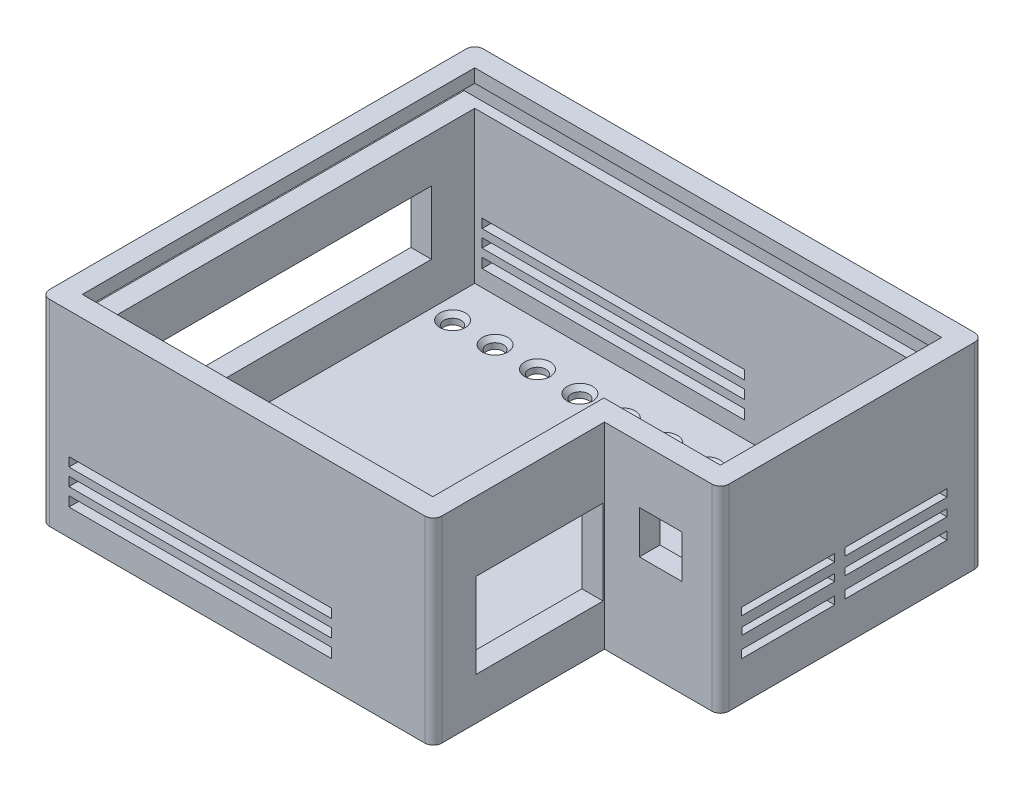
from build123d import *

# Parameters (mm, degrees)
BOSS_EXTRUDE1_DEPTH = 55.88
SKETCH25_W          = 88.9
SKETCH25_H          = 19.05
CUT_EXTRUDE9_DEPTH  = 45
SKETCH26_W          = 30.523269702
SKETCH26_H          = 2.237493103
SKETCH26_W_2        = 27.906523593
SKETCH26_H_2        = 2.373023229
SKETCH26_W_3        = 27.753916876
SKETCH26_H_3        = 2.119290111
SKETCH26_W_4        = 27.886795766
CUT_EXTRUDE10_DEPTH = 45
SKETCH27_W          = 78.529626093
SKETCH27_H          = 2.934693649
SKETCH27_H_2        = 2.6992147
SKETCH27_H_3        = 2.709324196
CUT_EXTRUDE11_DEPTH = 254
SKETCH23_W          = 12.7
SKETCH23_H          = 12.812800452
CUT_EXTRUDE12_DEPTH = 50.8
SKETCH31_W          = 123.564738067
SKETCH31_H          = 6.504927573
CUT_EXTRUDE13_DEPTH = 113.8
SKETCH34_W          = 2.794
SKETCH34_H          = 6
SKETCH34_W_2        = 3
SKETCH34_H_2        = 6.504927573
CUT_EXTRUDE14_DEPTH = 35.8
SKETCH35_W          = 66.242375008
SKETCH35_H          = 6
CUT_EXTRUDE15_DEPTH = 2.8
BOSS_EXTRUDE2_DEPTH = 3
SKETCH38_W          = 38.1
SKETCH38_H          = 25.4
CUT_EXTRUDE17_DEPTH = 10.16
FILLET1_R           = 2.54
SKETCH37_R          = 2.54
CUT_EXTRUDE18_DEPTH = 5.842
CHAMFER1_SIZE       = 1.27


with BuildPart() as part:
    # Sketch1 → Boss-Extrude1 (new body)
    with BuildSketch(Plane(origin=(0, 0, 0), x_dir=(1, 0, 0), z_dir=(0, 1, 0))):
        Polygon((104.775, 6.175), (-6.175, 6.175), (-6.175, -123.65), (104.902, -123.65), (111.252, -123.65), (111.252, -72.417375008), (145.95, -72.417375008), (145.95, 6.175), align=None)
        Polygon((0, 0), (104.775, 0), (139.775, 0), (139.775, -66.242375008), (107.949403386, -66.242375008), (104.902, -66.242375008), (104.902, -117.475), (0, -117.475), align=None, mode=Mode.SUBTRACT)
    extrude(amount=BOSS_EXTRUDE1_DEPTH)

    # Sketch25 → Cut-Extrude9 (cut)
    with BuildSketch(Plane.ZY.offset(6.175)):
        with Locations((57.39554729, 22.225)):
            Rectangle(SKETCH25_W, SKETCH25_H)
    extrude(amount=-CUT_EXTRUDE9_DEPTH, mode=Mode.SUBTRACT)

    # Sketch26 → Cut-Extrude10 (cut)
    with BuildSketch(Plane(origin=(145.95, 0, 0), x_dir=(0, 0, -1), z_dir=(1, 0, 0))):
        with Locations((-19.859686164, 20.955094684)):
            Rectangle(SKETCH26_W, SKETCH26_H)
        with Locations((-52.150571232, 9.901663162)):
            Rectangle(SKETCH26_W_2, SKETCH26_H_2)
        with Locations((-19.859686164, 9.901663162)):
            Rectangle(SKETCH26_W, SKETCH26_H_2)
        with Locations((-52.074267873, 15.812585987)):
            Rectangle(SKETCH26_W_3, SKETCH26_H_3)
        with Locations((-19.859686164, 15.812585987)):
            Rectangle(SKETCH26_W, SKETCH26_H_3)
        with Locations((-52.140707318, 20.955094684)):
            Rectangle(SKETCH26_W_4, SKETCH26_H)
    extrude(amount=-CUT_EXTRUDE10_DEPTH, mode=Mode.SUBTRACT)

    # Sketch27 → Cut-Extrude11 (cut)
    with BuildSketch(Plane(origin=(0, 0, -6.175), x_dir=(-1, 0, 0), z_dir=(0, 0, -1))):
        with Locations((-41.456138019, 6.407058623)):
            Rectangle(SKETCH27_W, SKETCH27_H)
        with Locations((-41.456138019, 11.590217132)):
            Rectangle(SKETCH27_W, SKETCH27_H_2)
        with Locations((-41.456138019, 16.660698202)):
            Rectangle(SKETCH27_W, SKETCH27_H_3)
    extrude(amount=-CUT_EXTRUDE11_DEPTH, mode=Mode.SUBTRACT)

    # Sketch23 → Cut-Extrude12 (cut)
    with BuildSketch(Plane.XY.offset(72.417375008)):
        with Locations((128.04011729, 32.5625418)):
            Rectangle(SKETCH23_W, SKETCH23_H)
    extrude(amount=-CUT_EXTRUDE12_DEPTH, mode=Mode.SUBTRACT)

    # Sketch31 → Cut-Extrude13 (cut)
    with BuildSketch(Plane.ZY.offset(6.175)):
        with Locations((58.782369034, 48.622896581)):
            Rectangle(SKETCH31_W, SKETCH31_H)
    extrude(amount=-CUT_EXTRUDE13_DEPTH, mode=Mode.SUBTRACT)

    # Sketch34 → Cut-Extrude14 (cut)
    with BuildSketch(Plane.ZY.offset(-107.625)):
        with Locations((67.639375008, 48.370432794)):
            Rectangle(SKETCH34_W, SKETCH34_H)
        with Locations((-1.5, 48.622896581)):
            Rectangle(SKETCH34_W_2, SKETCH34_H_2)
    extrude(amount=-CUT_EXTRUDE14_DEPTH, mode=Mode.SUBTRACT)

    # Sketch35 → Cut-Extrude15 (cut)
    with BuildSketch(Plane.ZY.offset(-139.775)):
        with Locations((33.121187504, 48.370432794)):
            Rectangle(SKETCH35_W, SKETCH35_H)
    extrude(amount=-CUT_EXTRUDE15_DEPTH, mode=Mode.SUBTRACT)

    # Sketch36 → Boss-Extrude2 (add)
    with BuildSketch(Plane.XZ):
        Polygon((111.252, 72.417375008), (111.252, 123.65), (-6.175, 123.65), (-6.175, -6.175), (145.95, -6.175), (145.95, 72.417375008), align=None)
    extrude(amount=BOSS_EXTRUDE2_DEPTH)

    # Sketch38 → Cut-Extrude17 (cut)
    with BuildSketch(Plane(origin=(111.252, 0, 0), x_dir=(0, 0, -1), z_dir=(1, 0, 0))):
        with Locations((-91.9, 22.4)):
            Rectangle(SKETCH38_W, SKETCH38_H)
    extrude(amount=-CUT_EXTRUDE17_DEPTH, mode=Mode.SUBTRACT)

    # Fillet1
    fillet1_edges = [part.edges().sort_by_distance(p)[0] for p in [
        (-6.175, 26.44, 123.65),
        (-6.175, 26.44, -6.175),
        (111.252, 26.44, 123.65),
        (145.95, 26.44, 72.417375008),
        (145.95, 26.44, -6.175),
    ]]
    fillet(fillet1_edges, radius=FILLET1_R)

    # Sketch37 → Cut-Extrude18 (cut)
    with BuildSketch(Plane(origin=(145.95, -3, 72.417375008), x_dir=(1, 0, 0), z_dir=(0, -1, 0))):
        with Locations((-12.7, -59.542375008)):
            Circle(SKETCH37_R)
        with Locations((-63.5, 29.357624992)):
            Circle(SKETCH37_R)
        with Locations((-114.3, 29.357624992)):
            Circle(SKETCH37_R)
        with Locations((-25.4, -59.542375008)):
            Circle(SKETCH37_R)
        with Locations((-38.1, -59.542375008)):
            Circle(SKETCH37_R)
        with Locations((-50.8, -59.542375008)):
            Circle(SKETCH37_R)
        with Locations((-63.5, -59.542375008)):
            Circle(SKETCH37_R)
        with Locations((-76.2, -59.542375008)):
            Circle(SKETCH37_R)
        with Locations((-88.9, -59.542375008)):
            Circle(SKETCH37_R)
        with Locations((-101.6, -59.542375008)):
            Circle(SKETCH37_R)
        with Locations((-114.3, -59.542375008)):
            Circle(SKETCH37_R)
        with Locations((-127, -59.542375008)):
            Circle(SKETCH37_R)
        with Locations((-139.7, -59.542375008)):
            Circle(SKETCH37_R)
    extrude(amount=-CUT_EXTRUDE18_DEPTH, mode=Mode.SUBTRACT)

    # Chamfer1
    chamfer1_edges = [part.edges().sort_by_distance(p)[0] for p in [
        (29.11, 0, 101.775),
        (79.91, 0, 101.775),
        (3.71, 0, 12.875),
        (16.41, 0, 12.875),
        (29.11, 0, 12.875),
        (41.81, 0, 12.875),
        (54.51, 0, 12.875),
        (67.21, 0, 12.875),
        (79.91, 0, 12.875),
        (92.61, 0, 12.875),
        (105.31, 0, 12.875),
        (118.01, 0, 12.875),
        (130.71, 0, 12.875),
    ]]
    chamfer(chamfer1_edges, length=CHAMFER1_SIZE)


solid = part.part
